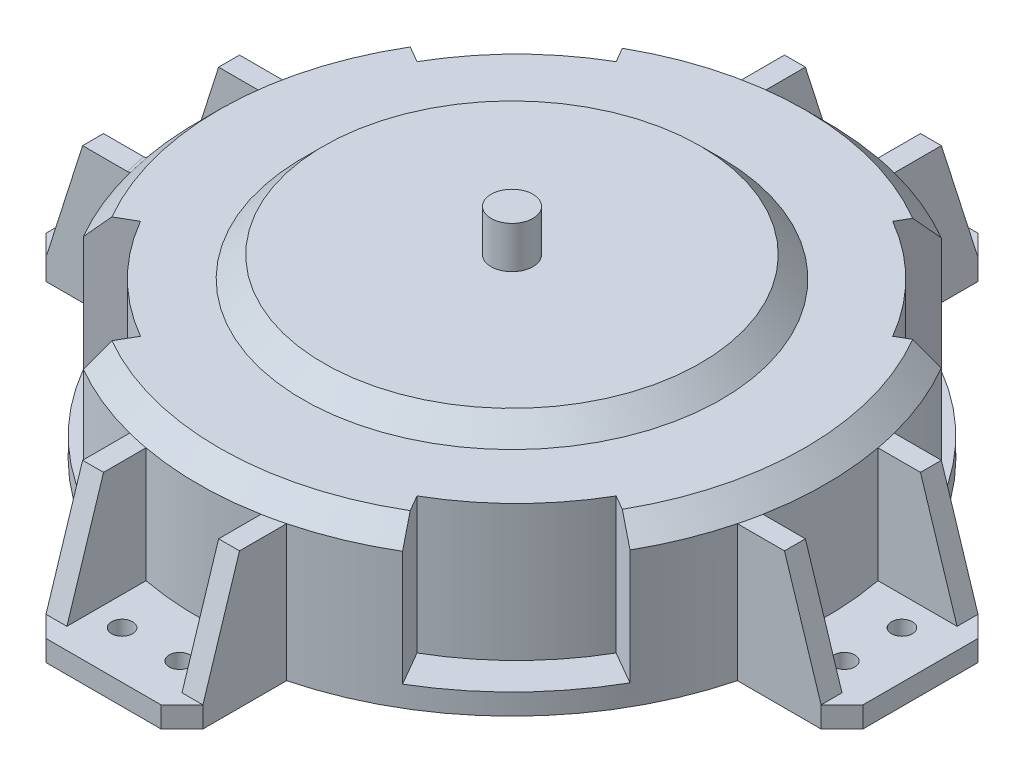
from build123d import *

# Parameters (mm, degrees)
SKETCH1_R                    = 150
BOSS_EXTRUDE1_DEPTH          = 75
CHAMFER1_SIZE                = 10
BOSS_EXTRUDE2_START          = -75
BOSS_EXTRUDE2_DEPTH          = 10
CHAMFER2_SIZE                = 10
BOSS_EXTRUDE3_DEPTH          = 10
SKETCH4_R                    = 5
CUT_EXTRUDE1_DEPTH           = 10
FILLET1_R                    = 2.5
FILLET2_R                    = 2.5
FILLET3_R                    = 2.5
CIRPATTERN4_COUNT            = 4
CIRPATTERN4_COPY_1_DEPTH     = 10
CIRPATTERN4_COPY_2_DEPTH     = 10
CIRPATTERN4_COPY_3_DEPTH     = 10
CIRPATTERN4_COPY_4_SKETCH_R  = 5
CIRPATTERN4_COPY_4_DEPTH     = 10
CIRPATTERN4_COPY_5_SKETCH_R  = 5
CIRPATTERN4_COPY_5_DEPTH     = 10
CIRPATTERN4_COPY_6_SKETCH_R  = 5
CIRPATTERN4_COPY_6_DEPTH     = 10
CHAMFER2_OF_CIRPATTERN4_SIZE = 10
CUT_EXTRUDE2_START           = -65
CUT_EXTRUDE2_DEPTH           = 65
CIRPATTERN5_COUNT            = 4
SKETCH6_R                    = 100
BOSS_EXTRUDE4_DEPTH          = 10
CHAMFER3_SIZE                = 10
SKETCH7_R                    = 10
BOSS_EXTRUDE5_DEPTH          = 20


# Some blends are built 0.0001 mm under size
with BuildPart() as part:
    # Sketch1 → Boss-Extrude1 (new body)
    with BuildSketch(Plane(origin=(0, 0, 0), x_dir=(1, 0, 0), z_dir=(0, 1, 0))):
        with Locations(Location((0, 0, 0), (0, 0, 270))):
            Circle(SKETCH1_R)
    extrude(amount=BOSS_EXTRUDE1_DEPTH)

    # Chamfer1
    chamfer1_edges = [part.edges().sort_by_distance(p)[0] for p in [
        (0, 75, -150),
    ]]
    chamfer(chamfer1_edges, length=CHAMFER1_SIZE)

    # Sketch2 → Boss-Extrude2 (add)
    with BuildSketch(Plane(origin=(0, 75, 0), x_dir=(1, 0, 0), z_dir=(0, 1, 0)).offset(BOSS_EXTRUDE2_START)):
        with BuildLine():
            Line((-195.236875483, -37.5), (-195.236875483, 37.5))
            Line((-195.236875483, 37.5), (-145.236875483, 37.5))
            ThreePointArc((-145.236875483, 37.5), (-150, 0), (-145.236875483, -37.5))
            Line((-145.236875483, -37.5), (-195.236875483, -37.5))
        make_face()
    boss_extrude2 = extrude(amount=BOSS_EXTRUDE2_DEPTH)

    # Chamfer2
    chamfer2_edges = [part.edges().sort_by_distance(p)[0] for p in [
        (-195.236875483, 5, -37.5),
        (-195.236875483, 5, 37.5),
    ]]
    chamfer(chamfer2_edges, length=CHAMFER2_SIZE)

    # Sketch3 → Boss-Extrude3 (add)
    with BuildSketch(Plane.XY.offset(37.5)):
        Polygon((-145.236875483, 0), (-145.236875483, 65), (-167.736875483, 65), (-185.236875483, 10), (-185.236875483, 0), align=None)
    boss_extrude3 = extrude(amount=-BOSS_EXTRUDE3_DEPTH)

    # Sketch4 → Cut-Extrude1 (cut)
    with BuildSketch(Plane(origin=(0, 10, 0), x_dir=(1, 0, 0), z_dir=(0, 1, 0))):
        with Locations(Location((-172.618437741, -13.75, 0), (0, 0, 270))):
            Circle(SKETCH4_R)
    cut_extrude1 = extrude(amount=-CUT_EXTRUDE1_DEPTH, mode=Mode.SUBTRACT)

    # Mirror2: Boss-Extrude3, Cut-Extrude1 across plane
    add(boss_extrude3.mirror(Plane(origin=(0, 0, 0), x_dir=(1, 0, 0), z_dir=(0, 0, -1))))
    add(cut_extrude1.mirror(Plane(origin=(0, 0, 0), x_dir=(1, 0, 0), z_dir=(0, 0, -1))), mode=Mode.SUBTRACT)

    # Fillet1
    fillet1_edges = [part.edges().sort_by_distance(p)[0] for p in [
        (-166.347248257, 10, -27.5),
        (-185.236875483, 10, -32.5),
    ]]
    fillet(fillet1_edges, radius=FILLET1_R)

    # Fillet2
    fillet2_edges = [part.edges().sort_by_distance(p)[0] for p in [
        (-166.347248257, 10, 27.5),
        (-185.236875483, 10, 32.5),
    ]]
    fillet(fillet2_edges, radius=FILLET2_R)

    # Fillet3
    # the kernel refuses this fillet: 2.5 mm, written as the material it adds along each edge
    with BuildSketch(Plane(origin=(0, 65, 0), x_dir=(-0.9860683765202287, 0, 0.1663404846294499), z_dir=(-0.1663404846294499, 0, -0.9860683765202287))) as fillet3_piece_1_section:
        with BuildLine():
            CenterArc((150 + FILLET3_R * 0.414213562373, FILLET3_R), FILLET3_R, 225, 45)
            Line((150 + FILLET3_R * 0.414213562373, 0), (150, 0))
            Line((150, 0), (150 - FILLET3_R * 0.292893218813, FILLET3_R * 0.292893218813))
        make_face()
    fillet3_piece_1 = revolve(axis=Axis((0, 65, 0), (0, 1, 0)), revolution_arc=5.891260177, mode=Mode.PRIVATE)
    fillet3_piece_1 = split(fillet3_piece_1, bisect_by=Plane(origin=(-146.208853891, 65.259294833, 27.5), z_dir=(0, 0, 1)), keep=Keep.TOP, mode=Mode.PRIVATE)
    fillet3_piece_1 = split(fillet3_piece_1, bisect_by=Plane(origin=(-146.208853891, 65.259294833, 37.5), z_dir=(0, 0, -1)), keep=Keep.TOP, mode=Mode.PRIVATE)
    add(fillet3_piece_1)
    with BuildSketch(Plane(origin=(0, 65, 0), x_dir=(-0.9637871207414556, 0, -0.2666728068118214), z_dir=(0.2666728068118214, 0, -0.9637871207414556))) as fillet3_piece_2_section:
        with BuildLine():
            CenterArc((150 + FILLET3_R * 0.414213562373, FILLET3_R), FILLET3_R, 225, 45)
            Line((150 + FILLET3_R * 0.414213562373, 0), (150, 0))
            Line((150, 0), (150 - FILLET3_R * 0.292893218813, FILLET3_R * 0.292893218813))
        make_face()
    fillet3_piece_2 = revolve(axis=Axis((0, 65, 0), (0, 1, 0)), revolution_arc=5.891260177, mode=Mode.PRIVATE)
    fillet3_piece_2 = split(fillet3_piece_2, bisect_by=Plane(origin=(-146.20885389, 65.259294833, -27.5), z_dir=(0, 0, -1)), keep=Keep.TOP, mode=Mode.PRIVATE)
    fillet3_piece_2 = split(fillet3_piece_2, bisect_by=Plane(origin=(-146.20885389, 65.259294833, -37.5), z_dir=(0, 0, 1)), keep=Keep.TOP, mode=Mode.PRIVATE)
    add(fillet3_piece_2)

    # CirPattern4: Boss-Extrude2, Boss-Extrude3, Cut-Extrude1 ×4 about axis
    cirpattern4_axis = Axis((0, 0, 0), (0, 1, 0))
    add([boss_extrude2.rotate(cirpattern4_axis, i * 360 / CIRPATTERN4_COUNT) for i in range(1, CIRPATTERN4_COUNT)])
    add([boss_extrude3.rotate(cirpattern4_axis, i * 360 / CIRPATTERN4_COUNT) for i in range(1, CIRPATTERN4_COUNT)])
    add([cut_extrude1.rotate(cirpattern4_axis, i * 360 / CIRPATTERN4_COUNT) for i in range(1, CIRPATTERN4_COUNT)], mode=Mode.SUBTRACT)

    # CirPattern4 copy 1 sketch → CirPattern4 copy 1 (add)
    with BuildSketch(Plane(origin=(-37.5, 0, 0), x_dir=(0, 0, -1), z_dir=(-1, 0, 0))):
        Polygon((-145.236875483, 0), (-145.236875483, -65), (-167.736875483, -65), (-185.236875483, -10), (-185.236875483, 0), align=None)
    extrude(amount=-CIRPATTERN4_COPY_1_DEPTH)

    # CirPattern4 copy 2 sketch → CirPattern4 copy 2 (add)
    with BuildSketch(Plane(origin=(0, 0, 37.5), x_dir=(-1, 0, 0), z_dir=(0, 0, 1))):
        Polygon((-145.236875483, 0), (-145.236875483, -65), (-167.736875483, -65), (-185.236875483, -10), (-185.236875483, 0), align=None)
    extrude(amount=-CIRPATTERN4_COPY_2_DEPTH)

    # CirPattern4 copy 3 sketch → CirPattern4 copy 3 (add)
    with BuildSketch(Plane(origin=(37.5, 0, 0), x_dir=(0, 0, 1), z_dir=(1, 0, 0))):
        Polygon((-145.236875483, 0), (-145.236875483, -65), (-167.736875483, -65), (-185.236875483, -10), (-185.236875483, 0), align=None)
    extrude(amount=-CIRPATTERN4_COPY_3_DEPTH)

    # CirPattern4 copy 4 sketch → CirPattern4 copy 4 (cut)
    with BuildSketch(Plane(origin=(0, 10, 0), x_dir=(0, 0, -1), z_dir=(0, 1, 0))):
        with Locations((-172.618437741, 13.75)):
            Circle(CIRPATTERN4_COPY_4_SKETCH_R)
    extrude(amount=-CIRPATTERN4_COPY_4_DEPTH, mode=Mode.SUBTRACT)

    # CirPattern4 copy 5 sketch → CirPattern4 copy 5 (cut)
    with BuildSketch(Plane(origin=(0, 10, 0), x_dir=(-1, 0, 0), z_dir=(0, 1, 0))):
        with Locations((-172.618437741, 13.75)):
            Circle(CIRPATTERN4_COPY_5_SKETCH_R)
    extrude(amount=-CIRPATTERN4_COPY_5_DEPTH, mode=Mode.SUBTRACT)

    # CirPattern4 copy 6 sketch → CirPattern4 copy 6 (cut)
    with BuildSketch(Plane.ZX.offset(10)):
        with Locations((-172.618437741, 13.75)):
            Circle(CIRPATTERN4_COPY_6_SKETCH_R)
    extrude(amount=-CIRPATTERN4_COPY_6_DEPTH, mode=Mode.SUBTRACT)

    # Chamfer2 of CirPattern4
    chamfer2_of_cirpattern4_edges = [part.edges().sort_by_distance(p)[0] for p in [
        (-37.5, 5, 195.236875483),
        (37.5, 5, 195.236875483),
        (195.236875483, 5, 37.5),
        (195.236875483, 5, -37.5),
        (37.5, 5, -195.236875483),
        (-37.5, 5, -195.236875483),
    ]]
    chamfer(chamfer2_of_cirpattern4_edges, length=CHAMFER2_OF_CIRPATTERN4_SIZE)

    # Sketch5 → Cut-Extrude2 (cut)
    with BuildSketch(Plane(origin=(0, 75, 0), x_dir=(1, 0, 0), z_dir=(0, 1, 0)).offset(CUT_EXTRUDE2_START)):
        with BuildLine():
            Line((-112.583302492, -65), (-129.903810568, -75))
            ThreePointArc((-129.903810568, -75), (-106.066017178, -106.066017178), (-75, -129.903810568))
            Line((-75, -129.903810568), (-65, -112.583302492))
            ThreePointArc((-65, -112.583302492), (-91.923881554, -91.923881554), (-112.583302492, -65))
        make_face()
    cut_extrude2 = extrude(amount=CUT_EXTRUDE2_DEPTH, mode=Mode.SUBTRACT)

    # CirPattern5: Cut-Extrude2 ×4 about axis
    cirpattern5_axis = Axis((1.096442134, 0, -1.096442134), (0, 1, 0))
    for i in range(1, CIRPATTERN5_COUNT):
        add(cut_extrude2.rotate(cirpattern5_axis, i * 360 / CIRPATTERN5_COUNT), mode=Mode.SUBTRACT)

    # Sketch6 → Boss-Extrude4 (add)
    with BuildSketch(Plane(origin=(0, 75, 0), x_dir=(1, 0, 0), z_dir=(0, 1, 0))):
        with Locations(Location((0, 0, 0), (0, 0, 270))):
            Circle(SKETCH6_R)
    extrude(amount=BOSS_EXTRUDE4_DEPTH)

    # Chamfer3
    chamfer3_edges = [part.edges().sort_by_distance(p)[0] for p in [
        (0, 85, -100),
    ]]
    chamfer(chamfer3_edges, length=CHAMFER3_SIZE - 0.0001)  # a hair under: the kernel refuses the full size

    # Sketch7 → Boss-Extrude5 (add)
    with BuildSketch(Plane(origin=(0, 85, 0), x_dir=(1, 0, 0), z_dir=(0, 1, 0))):
        with Locations(Location((0, 0, 0), (0, 0, 270))):
            Circle(SKETCH7_R)
    extrude(amount=BOSS_EXTRUDE5_DEPTH)


solid = part.part
